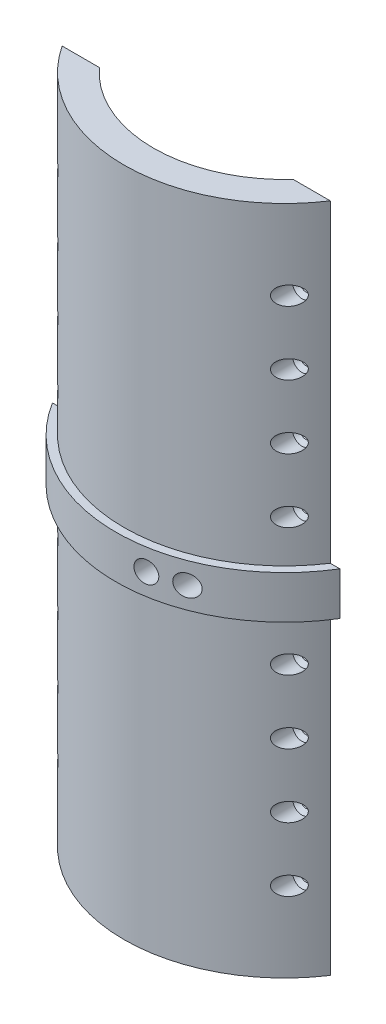
from build123d import *

# Parameters (mm, degrees)
BOSS_EXTRUDE1_DEPTH      = 210
LPATTERN1_COUNT          = 9
LPATTERN1_PITCH          = 20
BOSS_EXTRUDE2_DEPTH      = 6.731
BOSS_EXTRUDE2_DEPTH_BACK = 6.731
SKETCH9_R                = 3.334469726
CUT_EXTRUDE1_DEPTH       = 34


with BuildPart() as part:
    # Sketch1 → Boss-Extrude1 (new body)
    with BuildSketch(Plane(origin=(60.535204745, 0, -85.948449604), x_dir=(1, 0, 0), z_dir=(0, 1, 0))):
        with BuildLine():
            ThreePointArc((-30.186446753, -113.644462538), (-60.535204745, -127.035141416), (-90.883962736, -113.644462538))
            Line((-90.883962736, -113.644462538), (-102.513962844, -113.644462538))
            ThreePointArc((-102.513962844, -113.644462538), (-60.535204745, -136.240449604), (-18.556446645, -113.644462538))
            Line((-18.556446645, -113.644462538), (-30.186446753, -113.644462538))
        make_face()
    extrude(amount=BOSS_EXTRUDE1_DEPTH)

    # Sketch6 → Cut-Revolve4 (revolve, cut)
    with BuildSketch(Plane(origin=(36.163758045, 25, 27.696012934), x_dir=(-1, 0, 0), z_dir=(0, -1, 0))):
        Polygon((0, 1.685394277), (0, -4.78184701), (0, -15.185924704), (-2.9, -15.185924704), (-2.9, -3.079025683), (-1.65, -1.881964943), (-1.65, 1.685394277), align=None)
    cut_revolve4 = revolve(axis=Axis((36.163758045, 25, 26.010618657), (0, 0, 1)), mode=Mode.SUBTRACT)

    # LPattern1: Cut-Revolve4 ×9
    with Locations(*[(0, i * LPATTERN1_PITCH, 0) for i in range(1, LPATTERN1_COUNT)]):
        add(cut_revolve4, mode=Mode.SUBTRACT)

    # Mirror1: Cut-Revolve4 across plane
    add(cut_revolve4.mirror(Plane(origin=(0, 0, 0), x_dir=(0, 0, 1), z_dir=(1, 0, 0))), mode=Mode.SUBTRACT)

    # Mirror1 copy 1 sketch → Mirror1 copy 1 (revolve, cut)
    with BuildSketch(Plane(origin=(-36.163758045, 45, 27.696012934), x_dir=(1, 0, 0), z_dir=(0, -1, 0))):
        Polygon((0, -1.685394277), (0, 4.78184701), (0, 15.185924704), (-2.9, 15.185924704), (-2.9, 3.079025683), (-1.65, 1.881964943), (-1.65, -1.685394277), align=None)
    revolve(axis=Axis((-36.163758045, 45, 26.010618657), (0, 0, -1)), mode=Mode.SUBTRACT)

    # Mirror1 copy 2 sketch → Mirror1 copy 2 (revolve, cut)
    with BuildSketch(Plane(origin=(-36.163758045, 65, 27.696012934), x_dir=(1, 0, 0), z_dir=(0, -1, 0))):
        Polygon((0, -1.685394277), (0, 4.78184701), (0, 15.185924704), (-2.9, 15.185924704), (-2.9, 3.079025683), (-1.65, 1.881964943), (-1.65, -1.685394277), align=None)
    revolve(axis=Axis((-36.163758045, 65, 26.010618657), (0, 0, -1)), mode=Mode.SUBTRACT)

    # Mirror1 copy 3 sketch → Mirror1 copy 3 (revolve, cut)
    with BuildSketch(Plane(origin=(-36.163758045, 85, 27.696012934), x_dir=(1, 0, 0), z_dir=(0, -1, 0))):
        Polygon((0, -1.685394277), (0, 4.78184701), (0, 15.185924704), (-2.9, 15.185924704), (-2.9, 3.079025683), (-1.65, 1.881964943), (-1.65, -1.685394277), align=None)
    revolve(axis=Axis((-36.163758045, 85, 26.010618657), (0, 0, -1)), mode=Mode.SUBTRACT)

    # Mirror1 copy 4 sketch → Mirror1 copy 4 (revolve, cut)
    with BuildSketch(Plane(origin=(-36.163758045, 105, 27.696012934), x_dir=(1, 0, 0), z_dir=(0, -1, 0))):
        Polygon((0, -1.685394277), (0, 4.78184701), (0, 15.185924704), (-2.9, 15.185924704), (-2.9, 3.079025683), (-1.65, 1.881964943), (-1.65, -1.685394277), align=None)
    revolve(axis=Axis((-36.163758045, 105, 26.010618657), (0, 0, -1)), mode=Mode.SUBTRACT)

    # Mirror1 copy 5 sketch → Mirror1 copy 5 (revolve, cut)
    with BuildSketch(Plane(origin=(-36.163758045, 125, 27.696012934), x_dir=(1, 0, 0), z_dir=(0, -1, 0))):
        Polygon((0, -1.685394277), (0, 4.78184701), (0, 15.185924704), (-2.9, 15.185924704), (-2.9, 3.079025683), (-1.65, 1.881964943), (-1.65, -1.685394277), align=None)
    revolve(axis=Axis((-36.163758045, 125, 26.010618657), (0, 0, -1)), mode=Mode.SUBTRACT)

    # Mirror1 copy 6 sketch → Mirror1 copy 6 (revolve, cut)
    with BuildSketch(Plane(origin=(-36.163758045, 145, 27.696012934), x_dir=(1, 0, 0), z_dir=(0, -1, 0))):
        Polygon((0, -1.685394277), (0, 4.78184701), (0, 15.185924704), (-2.9, 15.185924704), (-2.9, 3.079025683), (-1.65, 1.881964943), (-1.65, -1.685394277), align=None)
    revolve(axis=Axis((-36.163758045, 145, 26.010618657), (0, 0, -1)), mode=Mode.SUBTRACT)

    # Mirror1 copy 7 sketch → Mirror1 copy 7 (revolve, cut)
    with BuildSketch(Plane(origin=(-36.163758045, 165, 27.696012934), x_dir=(1, 0, 0), z_dir=(0, -1, 0))):
        Polygon((0, -1.685394277), (0, 4.78184701), (0, 15.185924704), (-2.9, 15.185924704), (-2.9, 3.079025683), (-1.65, 1.881964943), (-1.65, -1.685394277), align=None)
    revolve(axis=Axis((-36.163758045, 165, 26.010618657), (0, 0, -1)), mode=Mode.SUBTRACT)

    # Mirror1 copy 8 sketch → Mirror1 copy 8 (revolve, cut)
    with BuildSketch(Plane(origin=(-36.163758045, 185, 27.696012934), x_dir=(1, 0, 0), z_dir=(0, -1, 0))):
        Polygon((0, -1.685394277), (0, 4.78184701), (0, 15.185924704), (-2.9, 15.185924704), (-2.9, 3.079025683), (-1.65, 1.881964943), (-1.65, -1.685394277), align=None)
    revolve(axis=Axis((-36.163758045, 185, 26.010618657), (0, 0, -1)), mode=Mode.SUBTRACT)

    # Sketch7 → Boss-Extrude2 (add, two sides: drawn at the far end of the back side and taken through both)
    with BuildSketch(Plane(origin=(0, 105, 0), x_dir=(-1, 0, 0), z_dir=(0, -1, 0)).offset(-BOSS_EXTRUDE2_DEPTH_BACK)):
        with BuildLine():
            Line((-44.990566695, -27.696012934), (-41.978758099, -27.696012934))
            ThreePointArc((-41.978758099, -27.696012934), (0, -50.292), (41.978758099, -27.696012934))
            Line((41.978758099, -27.696012934), (44.990566695, -27.696012934))
            ThreePointArc((44.990566695, -27.696012934), (0, -52.832), (-44.990566695, -27.696012934))
        make_face()
    extrude(amount=BOSS_EXTRUDE2_DEPTH + BOSS_EXTRUDE2_DEPTH_BACK)

    # Sketch9 → Cut-Extrude1 (cut)
    with BuildSketch(Plane(origin=(0, 0, 27.696012934), x_dir=(-1, 0, 0), z_dir=(0, 0, -1))):
        with Locations((-18.801989508, 105)):
            Circle(SKETCH9_R)
        with Locations((-8.69556827, 105)):
            Circle(SKETCH9_R)
    extrude(amount=-CUT_EXTRUDE1_DEPTH, mode=Mode.SUBTRACT)


solid = part.part
